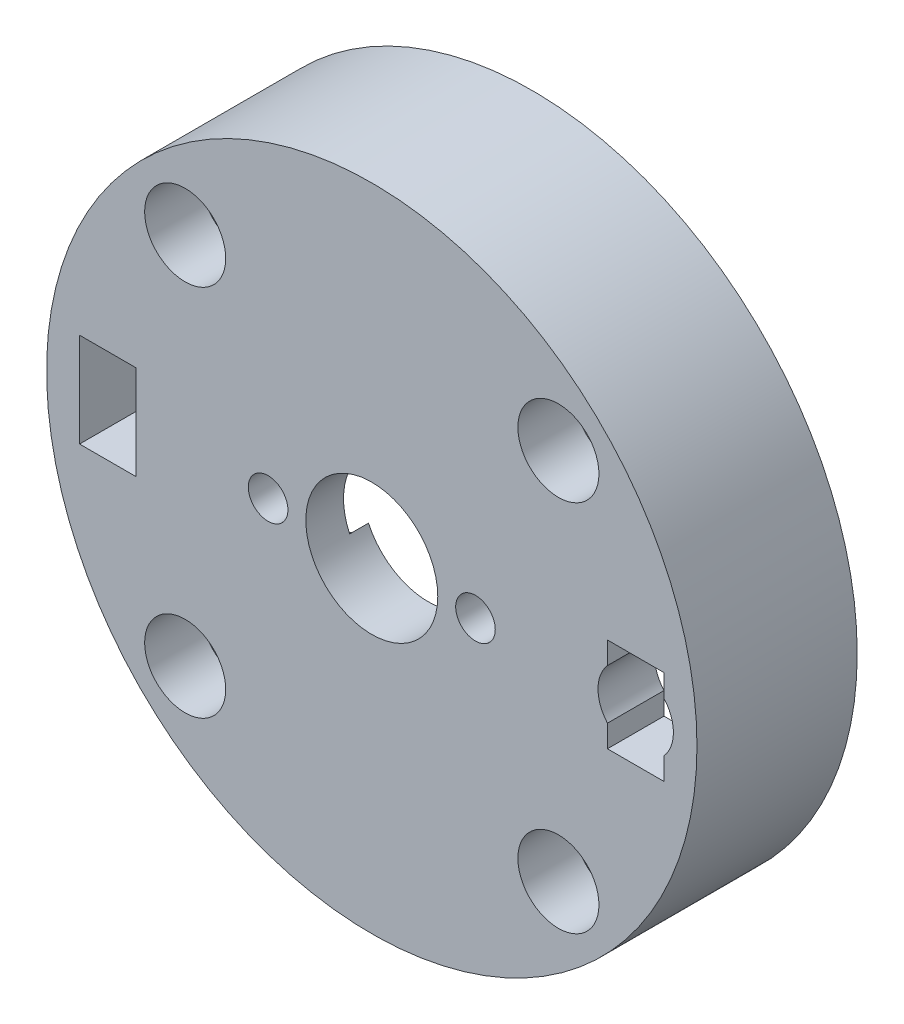
from build123d import *

# Parameters (mm, degrees)
SKETCH_1_R               = 20
EXTRUDE_1_DEPTH          = 2
SKETCH_2_R               = 3.5
CUT_EXTRUDE_1_DEPTH      = 2
SKETCH_3_R               = 1.05
CUT_EXTRUDE_2_DEPTH      = 2
EXTRUDE_START            = 1
SKETCH_5_R               = 20
SKETCH_5_R_2             = 8.25
EXTRUDE_3_DEPTH          = 1
EXTRUDE_4_DEPTH          = 1
SKETCH_9_R               = 10.2
SKETCH_9_R_2             = 7
CUT_EXTRUDE_3_DEPTH      = 1.6
EXTRUDE_START_2          = 1.6
EXTRUDE_5_DEPTH          = 1.6
PATTERN_CIRCULAR_2_COUNT = 2
SKETCH_13_R              = 2.75
CUT_EXTRUDE_4_DEPTH      = 1.6
FILLET_1_R               = 1.5
SKETCH_14_R              = 2.15
CUT_EXTRUDE_5_DEPTH      = 10
SKETCH_15_W              = 3
SKETCH_15_H              = 5
CUT_EXTRUDE_6_DEPTH      = 10
CHAMFER_1_SIZE           = 1
OTHER_START              = -10.264946541
OTHER_4149_OUTLINE_R     = 17.5
OTHER_4149_DEPTH         = 5.5
MOVE_BODY_2_ANGLE        = 45
CHAMFER_2_SIZE           = 1.191753593
CHAMFER_2_SIZE_2         = 1
CHAMFER_3_SIZE           = 3.575260778
CHAMFER_3_SIZE_2         = 3
SKETCH_19_OUTSIDE_W      = 53.44
SKETCH_19_OUTSIDE_H      = 53.44
SKETCH_19_OUTSIDE_R      = 17.25
CUT_EXTRUDE_7_DEPTH      = 25
CUT_EXTRUDE_9_DEPTH      = 10
CUT_EXTRUDE_9_DEPTH_BACK = 10
SKETCH_21_R              = 2
SKETCH_22_OUTSIDE_W      = 53.44
SKETCH_22_OUTSIDE_H      = 53.44
SKETCH_22_OUTSIDE_R      = 17.25
CUT_EXTRUDE_10_DEPTH     = 10


with BuildPart() as part:
    # 草图1 → 凸台-拉伸1 (new body)
    with BuildSketch(Plane.XY):
        Circle(SKETCH_1_R)
    extrude(amount=EXTRUDE_1_DEPTH)

    # 草图2 → 切除-拉伸1 (cut)
    with BuildSketch(Plane.XY.offset(2)):
        Circle(SKETCH_2_R)
    extrude(amount=-CUT_EXTRUDE_1_DEPTH, mode=Mode.SUBTRACT)

    # 草图3 → 切除-拉伸2 (cut)
    with BuildSketch(Plane.XY.offset(2)):
        with Locations((-5.5, 0)):
            Circle(SKETCH_3_R)
        with Locations((5.5, 0)):
            Circle(SKETCH_3_R)
    extrude(amount=-CUT_EXTRUDE_2_DEPTH, mode=Mode.SUBTRACT)

    # 草图5 → 凸台-拉伸3 (add)
    with BuildSketch(Plane(origin=(0, 0, 0), x_dir=(-1, 0, 0), z_dir=(0, 0, -1)).offset(EXTRUDE_START)):
        Circle(SKETCH_5_R)
        Circle(SKETCH_5_R_2, mode=Mode.SUBTRACT)
    extrude(amount=-EXTRUDE_3_DEPTH)

    # 草图8 → 凸台-拉伸4 (add)
    with BuildSketch(Plane(origin=(0, 0, 0), x_dir=(-1, 0, 0), z_dir=(0, 0, -1))):
        with BuildLine():
            ThreePointArc((3.176136364, 1.470427761), (6.265465545, 2.641318326), (8.25, 0))
            ThreePointArc((8.25, 0), (0, 8.25), (-8.25, 0))
            ThreePointArc((-8.25, 0), (-6.265465545, 2.641318326), (-3.176136364, 1.470427761))
            ThreePointArc((-3.176136364, 1.470427761), (0, 3.5), (3.176136364, 1.470427761))
        make_face()
        with BuildLine():
            ThreePointArc((-8.25, 0), (0, -8.25), (8.25, 0))
            ThreePointArc((8.25, 0), (6.265465545, -2.641318326), (3.176136364, -1.470427761))
            ThreePointArc((3.176136364, -1.470427761), (0, -3.5), (-3.176136364, -1.470427761))
            ThreePointArc((-3.176136364, -1.470427761), (-6.265465545, -2.641318326), (-8.25, 0))
        make_face()
    extrude(amount=EXTRUDE_4_DEPTH)

    # 草图9 → 切除-拉伸3 (cut)
    with BuildSketch(Plane(origin=(0, 0, -1), x_dir=(-1, 0, 0), z_dir=(0, 0, -1))):
        Circle(SKETCH_9_R)
        Circle(SKETCH_9_R_2, mode=Mode.SUBTRACT)
    extrude(amount=-CUT_EXTRUDE_3_DEPTH, mode=Mode.SUBTRACT)

    # 草图12 → 凸台-拉伸5 (add)
    with BuildSketch(Plane(origin=(0, 0, 0.6), x_dir=(-1, 0, 0), z_dir=(0, 0, -1)).offset(EXTRUDE_START_2)):
        with BuildLine():
            Line((6.344154509, 2.958327832), (9.244339428, 4.31070627))
            ThreePointArc((9.244339428, 4.31070627), (10.2, 0), (9.244339428, -4.31070627))
            Line((9.244339428, -4.31070627), (6.344154509, -2.958327832))
            ThreePointArc((6.344154509, -2.958327832), (7, 0), (6.344154509, 2.958327832))
        make_face()
    extrude_5 = extrude(amount=-EXTRUDE_5_DEPTH)

    # 阵列(圆周)2: 凸台-拉伸5 ×2 about axis
    pattern_circular_2_axis = Axis((0, 0, 0), (0, 0, 1))
    for i in range(1, PATTERN_CIRCULAR_2_COUNT):
        add(extrude_5.rotate(pattern_circular_2_axis, i * 360 / PATTERN_CIRCULAR_2_COUNT))

    # 草图13 → 切除-拉伸4 (cut)
    with BuildSketch(Plane(origin=(0, 0, 0), x_dir=(-1, 0, 0), z_dir=(0, 0, -1))):
        with Locations((5.5, 0)):
            Circle(SKETCH_13_R)
        with Locations((-5.5, 0)):
            Circle(SKETCH_13_R)
    extrude(amount=CUT_EXTRUDE_4_DEPTH, mode=Mode.SUBTRACT)

    # 圆角1
    # the kernel refuses this fillet: 1.5 mm, written as the material it adds along each edge
    with BuildSketch(Plane(origin=(6.344154509, 2.958327832, -1), x_dir=(0.9063077870366493, 0.42261826174070116, 0), z_dir=(0, 0, 1)), Plane(origin=(-6.344154509, -2.958327832, -1), x_dir=(-0.9063077870366493, -0.4226182617407009, 0), z_dir=(0, 0, 1))) as fillet_1_piece_1:
        with BuildLine():
            CenterArc((1.366600265, 1.5), FILLET_1_R, 190.164248622, 79.835751378)
            ThreePointArc((-0.109858605, 1.235294118), (-0.027518743, 0.620084766), (0, 0))
            Line((0, 0), (1.366600265, 0))
        make_face()
    extrude(amount=1.6)
    with BuildSketch(Plane(origin=(9.244339428, 4.31070627, -1), x_dir=(-0.4994572119030246, 0.8663385559226007, 0), z_dir=(0, 0, 1)), Plane(origin=(-9.244339428, -4.31070627, -1), x_dir=(0.49945721190302483, -0.8663385559226006, 0), z_dir=(0, 0, 1))) as fillet_1_piece_2:
        with BuildLine():
            CenterArc((1.635444705, 1.494373677), FILLET_1_R, 175.035904079, 99.928191842)
            Line((0.141071027, 1.624170876), (0, 0))
            ThreePointArc((0, 0), (0.882620952, -0.038258995), (1.765241903, 0))
        make_face()
    extrude(amount=1.6)
    with BuildSketch(Plane(origin=(9.244339428, -4.31070627, -1), x_dir=(-0.4994572119030251, -0.8663385559226003, 0), z_dir=(0, 0, 1)), Plane(origin=(-9.244339428, 4.31070627, -1), x_dir=(0.4994572119030254, 0.8663385559226003, 0), z_dir=(0, 0, 1))) as fillet_1_piece_3:
        with BuildLine():
            CenterArc((1.635444705, -1.494373677), FILLET_1_R, 85.035904079, 99.928191842)
            Line((0.141071027, -1.624170876), (0, 0))
            ThreePointArc((0, 0), (0.882620952, 0.038258995), (1.765241903, 0))
        make_face()
    extrude(amount=1.6)
    with BuildSketch(Plane(origin=(-6.344154509, 2.958327832, -1), x_dir=(-0.9063077870366493, 0.42261826174070083, 0), z_dir=(0, 0, 1)), Plane(origin=(6.344154509, -2.958327832, -1), x_dir=(0.9063077870366492, -0.4226182617407011, 0), z_dir=(0, 0, 1))) as fillet_1_piece_4:
        with BuildLine():
            CenterArc((1.366600265, -1.5), FILLET_1_R, 90, 79.835751378)
            ThreePointArc((-0.109858605, -1.235294118), (-0.027518743, -0.620084766), (0, 0))
            Line((0, 0), (1.366600265, 0))
        make_face()
    extrude(amount=1.6)

    # 草图14 → 切除-拉伸5 (cut)
    with BuildSketch(Plane(origin=(0, 0, -1), x_dir=(-1, 0, 0), z_dir=(0, 0, -1))):
        with Locations((9.899494937, -9.899494937)):
            Circle(SKETCH_14_R)
        with Locations((-9.899494937, -9.899494937)):
            Circle(SKETCH_14_R)
        with Locations((-9.899494937, 9.899494937)):
            Circle(SKETCH_14_R)
        with Locations((9.899494937, 9.899494937)):
            Circle(SKETCH_14_R)
    extrude(amount=-CUT_EXTRUDE_5_DEPTH, mode=Mode.SUBTRACT)

    # 草图15 → 切除-拉伸6 (cut)
    with BuildSketch(Plane.XY.offset(2)):
        with Locations((-14, 0)):
            Rectangle(SKETCH_15_W, SKETCH_15_H)
        with Locations((14, 0)):
            Rectangle(SKETCH_15_W, SKETCH_15_H)
    extrude(amount=-CUT_EXTRUDE_6_DEPTH, mode=Mode.SUBTRACT)

    # 倒角1
    chamfer_1_edges = [part.edges().sort_by_distance(p)[0] for p in [
        (20, 0, -1),
    ]]
    chamfer(chamfer_1_edges, length=CHAMFER_1_SIZE - 0.0001)  # a hair under: the kernel refuses the full size


with BuildPart() as body_2:
    # Other 4149: read off the stored shape, not the designer's step
    # Other 4149 outline → Other 4149 (new body)
    with BuildSketch(Plane.XY.offset(OTHER_START)):
        with Locations((-19.945533416, 28.7887379)):
            Circle(OTHER_4149_OUTLINE_R)
        with BuildLine():
            ThreePointArc((-9.043722475, 20.005201129), (-8.985378308, 17.828582791), (-11.161996645, 17.88692696))
            ThreePointArc((-11.161996645, 17.88692696), (-14.242692887, 16.0029016), (-17.70280961, 14.969541472))
            ThreePointArc((-17.70280961, 14.969541472), (-19.945533416, 12.5387379), (-22.188257221, 14.969541472))
            ThreePointArc((-22.188257221, 14.969541472), (-29.845028352, 18.889242964), (-33.764729844, 26.546014095))
            ThreePointArc((-33.764729844, 26.546014095), (-36.195533416, 28.788737901), (-33.764729844, 31.031461706))
            ThreePointArc((-33.764729844, 31.031461706), (-29.845028352, 38.688232837), (-22.188257221, 42.607934329))
            ThreePointArc((-22.188257221, 42.607934329), (-19.945533416, 45.0387379), (-17.70280961, 42.607934329))
            ThreePointArc((-17.70280961, 42.607934329), (-10.046038479, 38.688232837), (-6.126336987, 31.031461706))
            ThreePointArc((-6.126336987, 31.031461706), (-3.695533416, 28.788737901), (-6.126336987, 26.546014095))
            ThreePointArc((-6.126336987, 26.546014095), (-7.159697115, 23.085897372), (-9.043722475, 20.005201129))
        make_face(mode=Mode.SUBTRACT)
    extrude(amount=OTHER_4149_DEPTH)


with BuildPart() as body_2_1:
    # Move Body 2: read off the stored shape, not the designer's step
    # Move Body 2: moved
    add(body_2.part.moved(Location((19.9455334, -28.7887379, 3.7649465))).rotate(Axis((0, 0, 0), (0, 0, 1)), MOVE_BODY_2_ANGLE))

    # Combine 1: union part
    add(part.part)

    # 倒角2
    # the kernel refuses this chamfer: 1.191753593, 1 mm, written as the material it takes off along each edge
    with BuildSketch(Plane(origin=(13.999999989, -1.1e-08, -1.000000041), x_dir=(1, 0, 0), z_dir=(0, 1, 0))) as chamfer_2_piece_1_section:
        Polygon((1.5, CHAMFER_2_SIZE), (1.5 + CHAMFER_2_SIZE_2, 0), (1.5, 0), align=None)
    chamfer_2_piece_1 = revolve(axis=Axis((13.999999989, -1.1e-08, -1.000000041), (0, 0, -1)), revolution_arc=210.449028023, mode=Mode.PRIVATE)
    chamfer_2_piece_1 = split(chamfer_2_piece_1, bisect_by=Plane(origin=(15.5, -1.1e-08, -1.000000041), z_dir=(-1, 0, 0)), keep=Keep.TOP, mode=Mode.PRIVATE)
    add(chamfer_2_piece_1, mode=Mode.SUBTRACT)
    with BuildSketch(Plane(origin=(13.999999989, -1.1e-08, -1.000000041), x_dir=(-0.8620803404154466, -0.506771631673664, 0), z_dir=(0.506771631673664, -0.8620803404154466, 0))) as chamfer_2_piece_2_section:
        Polygon((1.5, CHAMFER_2_SIZE), (1.5 + CHAMFER_2_SIZE_2, 0), (1.5, 0), align=None)
    chamfer_2_piece_2 = revolve(axis=Axis((13.999999989, -1.1e-08, -1.000000041), (0, 0, -1)), revolution_arc=210.449027996, mode=Mode.PRIVATE)
    chamfer_2_piece_2 = split(chamfer_2_piece_2, bisect_by=Plane(origin=(15.5, -1.1e-08, -1.000000041), z_dir=(-1, 0, 0)), keep=Keep.TOP, mode=Mode.PRIVATE)
    add(chamfer_2_piece_2, mode=Mode.SUBTRACT)

    # 倒角3
    # the kernel refuses this chamfer: 3.575260778, 3 mm, written as the material it takes off along each edge
    with BuildSketch(Plane(origin=(-1.1e-08, -1.1e-08, -1.000000041), x_dir=(-0.6691326945986151, -0.743142945212559, 0), z_dir=(0.743142945212559, -0.6691326945986151, 0))) as chamfer_3_piece_1_section:
        Polygon((14 + CHAMFER_3_SIZE, 0), (14, CHAMFER_3_SIZE_2), (14, 0), align=None)
    chamfer_3_piece_1 = revolve(axis=Axis((-1.1e-08, -1.1e-08, -1.000000041), (0, 0, -1)), revolution_arc=95.999678085, mode=Mode.PRIVATE)
    chamfer_3_piece_1 = split(chamfer_3_piece_1, bisect_by=Plane(origin=(-15.5, -1.1e-08, -1.000000041), z_dir=(1, 0, 0)), keep=Keep.TOP, mode=Mode.PRIVATE)
    chamfer_3_piece_1 = split(chamfer_3_piece_1, bisect_by=Plane(origin=(-1.1e-08, -2.5, -1.000000041), z_dir=(0, 1, 0)), keep=Keep.TOP, mode=Mode.PRIVATE)
    chamfer_3_piece_1 = split(chamfer_3_piece_1, bisect_by=Plane(origin=(-1.1e-08, 2.5, -1.000000041), z_dir=(0, -1, 0)), keep=Keep.TOP, mode=Mode.PRIVATE)
    add(chamfer_3_piece_1, mode=Mode.SUBTRACT)

    # 草图19 outside → 切除-拉伸7 (cut)
    with BuildSketch(Plane(origin=(0, 0, -1), x_dir=(-1, 0, 0), z_dir=(0, 0, -1))):
        Rectangle(SKETCH_19_OUTSIDE_W, SKETCH_19_OUTSIDE_H)
        with Locations(Location((0, 0, 0), (0, 0, 180))):
            Circle(SKETCH_19_OUTSIDE_R, mode=Mode.SUBTRACT)
    extrude(amount=CUT_EXTRUDE_7_DEPTH, mode=Mode.SUBTRACT)

    # 草图21 → 切除-拉伸9 (cut, two sides: drawn at the far end of the back side and taken through both)
    with BuildSketch(Plane(origin=(0, 0, -1), x_dir=(-1, 0, 0), z_dir=(0, 0, -1)).offset(-CUT_EXTRUDE_9_DEPTH_BACK)):
        with Locations((-14, 0)):
            Circle(SKETCH_21_R)
    extrude(amount=CUT_EXTRUDE_9_DEPTH + CUT_EXTRUDE_9_DEPTH_BACK, mode=Mode.SUBTRACT)

    # 草图22 outside → 切除-拉伸10 (cut)
    with BuildSketch(Plane(origin=(0, 0, -6.5), x_dir=(-1, 0, 0), z_dir=(0, 0, -1))):
        Rectangle(SKETCH_22_OUTSIDE_W, SKETCH_22_OUTSIDE_H)
        with Locations(Location((0, 0, 0), (0, 0, 180))):
            Circle(SKETCH_22_OUTSIDE_R, mode=Mode.SUBTRACT)
    extrude(amount=-CUT_EXTRUDE_10_DEPTH, mode=Mode.SUBTRACT)


solid = body_2_1.part
